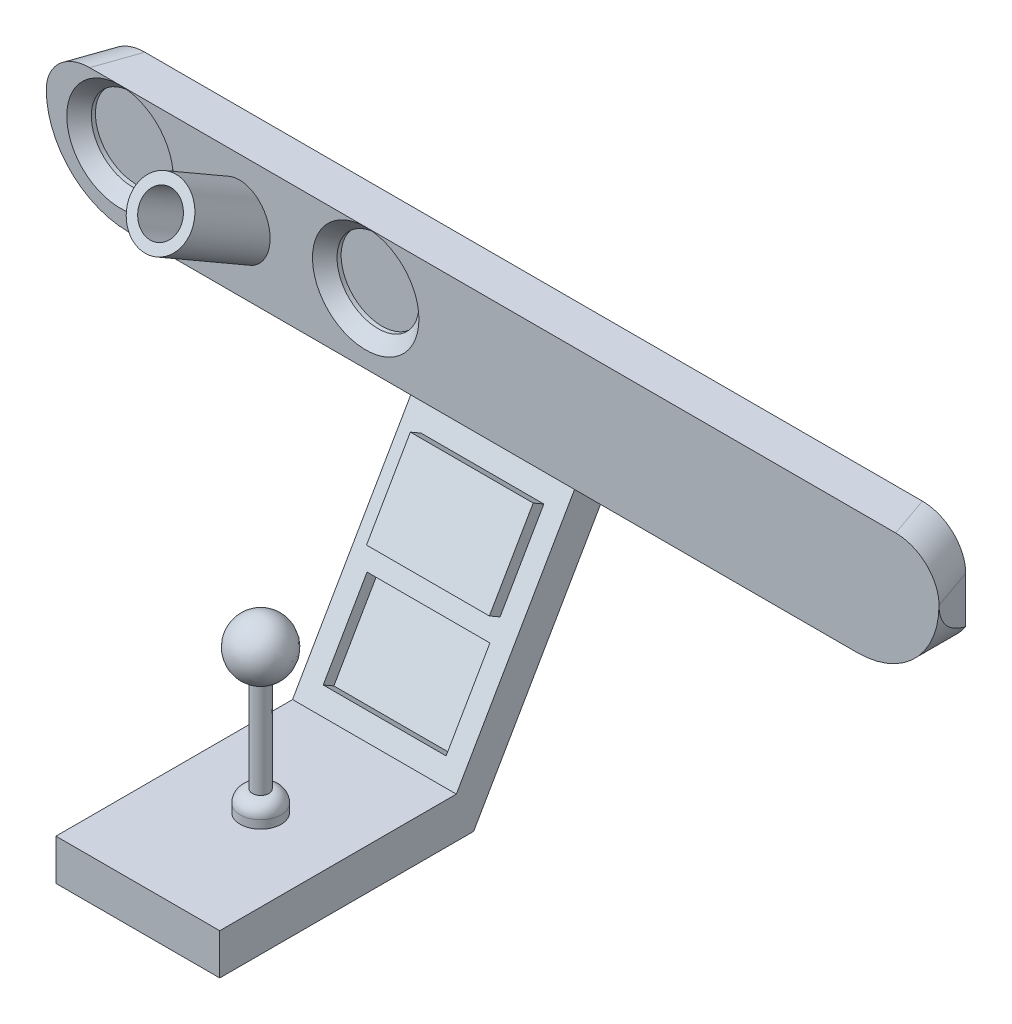
from build123d import *

# Parameters (mm, degrees)
SKETCH2_W            = 218
SKETCH2_H            = 30
BOSS_EXTRUDE1_DEPTH  = 5
FILLET1_R            = 20
SKETCH3_R            = 10
CUT_EXTRUDE1_DEPTH   = 4
SKETCH3_3_R          = 10
CUT_EXTRUDE2_DEPTH   = 4
CHAMFER1_SIZE        = 3
SKETCH6_R            = 5
CUT_EXTRUDE3_DEPTH   = 119.749210232
BOSS_EXTRUDE2_DEPTH  = 20
SKETCH8_W            = 30
SKETCH8_H            = 21.4
BOSS_EXTRUDE3_DEPTH  = 3
SKETCH10_W           = 30
SKETCH10_H           = 21.4
CUT_EXTRUDE4_DEPTH   = 3
CUT_EXTRUDE5_DEPTH   = 40
FILLET2_R            = 10
FILLET2_OF_MIRROR1_R = 10


with BuildPart() as part:
    # Sketch2 → Boss-Extrude1 (new, symmetric)
    with BuildSketch(Plane.XY):
        Rectangle(SKETCH2_W, SKETCH2_H)
    extrude(amount=BOSS_EXTRUDE1_DEPTH, both=True)

    # Fillet1
    fillet1_edges = [part.edges().sort_by_distance(p)[0] for p in [
        (109, -15, 0),
        (-109, -15, 0),
    ]]
    fillet(fillet1_edges, radius=FILLET1_R)

    # Sketch3 → Cut-Extrude1 (cut)
    with BuildSketch(Plane.XY.offset(5)):
        with Locations((-91, 2)):
            Circle(SKETCH3_R)
    extrude(amount=-CUT_EXTRUDE1_DEPTH, mode=Mode.SUBTRACT)

    # Sketch3<3> → Cut-Extrude2 (cut)
    with BuildSketch(Plane.XY.offset(5)):
        with Locations((-91, 2)):
            Circle(SKETCH3_3_R)
        with Locations((-31, 2)):
            Circle(SKETCH3_3_R)
    extrude(amount=-CUT_EXTRUDE2_DEPTH, mode=Mode.SUBTRACT)

    # Chamfer1
    chamfer1_edges = [part.edges().sort_by_distance(p)[0] for p in [
        (-101, 2, 5),
        (-41, 2, 5),
    ]]
    chamfer(chamfer1_edges, length=CHAMFER1_SIZE - 0.0001)  # a hair under: the kernel refuses the full size

    # Sketch5 → Revolve1 (revolve)
    with BuildSketch(Plane(origin=(-61.85, 0, 0), x_dir=(0, 0, -1), z_dir=(1, 0, 0)), mode=Mode.PRIVATE) as revolve1_sk:
        Polygon((-20.498711306, 18.495190528), (-24.248711306, 12), (10.392304845, -8), (14.142304845, -1.504809472), align=None)
    revolve(revolve1_sk.sketch.rotate(Axis((-61.85, 12, 24.248711306), (0, -0.49999999999999767, -0.86602540378444)), 180), axis=Axis((-61.85, 12, 24.248711306), (0, -0.49999999999999767, -0.86602540378444)))

    # Sketch6 → Cut-Extrude3 (cut, through all)
    with BuildSketch(Plane(origin=(0, 13.5, 23.382685902), x_dir=(1, 0, 0), z_dir=(0, 0.4999999999999978, 0.86602540378444))):
        with Locations(Location((-61.85, -1.732050808, 0), (0, 0, 270))):
            Circle(SKETCH6_R)
    extrude(amount=-CUT_EXTRUDE3_DEPTH, mode=Mode.SUBTRACT)

    # Sketch7 → Boss-Extrude2 (add, symmetric)
    with BuildSketch(Plane(origin=(0, 0, 0), x_dir=(0, 0, -1), z_dir=(1, 0, 0))):
        Polygon((5, -15), (-5, -15), (-33.867513459, -65), (-91.641016151, -65), (-91.641016151, -75), (-29.641016151, -75), align=None)
    extrude(amount=BOSS_EXTRUDE2_DEPTH, both=True)

    # Sketch8 → Boss-Extrude3 (add)
    with BuildSketch(Plane(origin=(0, -1.584936491, -2.745190528), x_dir=(1, 0, 0), z_dir=(0, 0.4999999999999978, 0.86602540378444))):
        with Locations((0, -31.190381057)):
            Rectangle(SKETCH8_W, SKETCH8_H)
    extrude(amount=BOSS_EXTRUDE3_DEPTH)

    # Sketch10 → Cut-Extrude4 (cut)
    with BuildSketch(Plane(origin=(0, -1.584936491, -2.745190528), x_dir=(1, 0, 0), z_dir=(0, 0.499999999999998, 0.8660254037844398))):
        with Locations((0, -57.525407976)):
            Rectangle(SKETCH10_W, SKETCH10_H)
    extrude(amount=-CUT_EXTRUDE4_DEPTH, mode=Mode.SUBTRACT)

    # Sketch11 → Revolve2 (revolve)
    with BuildSketch(Plane(origin=(0, 0, 0), x_dir=(0, 0, -1), z_dir=(1, 0, 0)), mode=Mode.PRIVATE) as revolve2_sk:
        with BuildLine():
            Line((-61.641016151, -23.08118878), (-61.641016151, -85))
            Line((-61.641016151, -85), (-54.141016151, -85))
            Line((-54.141016151, -85), (-54.141016151, -75))
            Line((-54.141016151, -75), (-56.641016151, -75))
            Line((-56.641016151, -75), (-56.641016151, -63))
            ThreePointArc((-56.641016151, -63), (-57.519695808, -60.878679656), (-59.641016151, -60))
            Line((-59.641016151, -60), (-59.641016151, -36.58459552))
            ThreePointArc((-59.641016151, -36.58459552), (-54.92395374, -28.986133621), (-61.641016151, -23.08118878))
        make_face()
    revolve(revolve2_sk.sketch.rotate(Axis((0, -23.08118878, 61.641016151), (0, -1, 0)), 180), axis=Axis((0, -23.08118878, 61.641016151), (0, -1, 0)))

    # Sketch12 → Cut-Extrude5 (cut)
    with BuildSketch(Plane(origin=(0, 15, 0), x_dir=(1, 0, 0), z_dir=(0, 1, 0))):
        Polygon((-109, -5), (-109, 5), (-105.52, 5), align=None)
    cut_extrude5 = extrude(amount=-CUT_EXTRUDE5_DEPTH, mode=Mode.SUBTRACT)

    # Fillet2
    fillet2_edges = [part.edges().sort_by_distance(p)[0] for p in [
        (-107.26, 15, 0),
    ]]
    fillet(fillet2_edges, radius=FILLET2_R)

    # Mirror1: Cut-Extrude5 across plane
    add(cut_extrude5.mirror(Plane(origin=(0, 0, 0), x_dir=(0, 0, 1), z_dir=(1, 0, 0))), mode=Mode.SUBTRACT)

    # Fillet2 of Mirror1
    fillet2_of_mirror1_edges = [part.edges().sort_by_distance(p)[0] for p in [
        (107.26, 15, 0),
    ]]
    fillet(fillet2_of_mirror1_edges, radius=FILLET2_OF_MIRROR1_R)


solid = part.part
